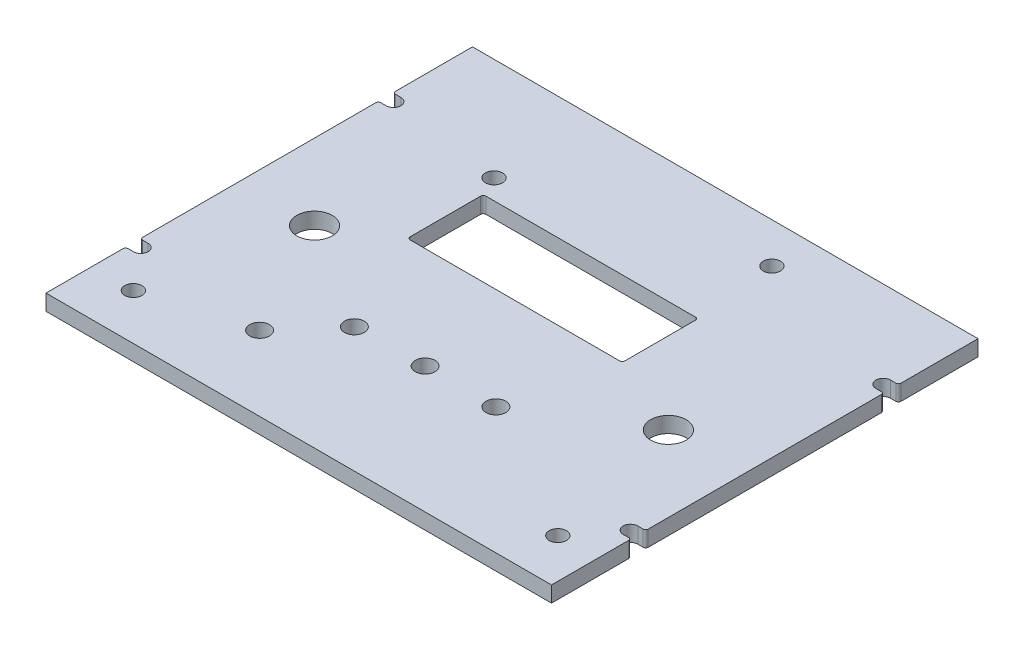
from build123d import *

# Parameters (mm, degrees)
SKETCH1_W                       = 101.6
SKETCH1_H                       = 85.725
BOSS_EXTRUDE1_DEPTH             = 3.175
F_29_0_136_DIAMETER_HOLE1_D     = 3.4544
F_9_32_0_28125_DIAMETER_HOLE1_D = 7.14375
F_5_32_0_15625_DIAMETER_HOLE1_D = 3.96875
SKETCH8_W                       = 43.18
SKETCH8_H                       = 15.24
CUT_EXTRUDE1_DEPTH              = 67.542576831
CUT_EXTRUDE2_DEPTH              = 67.542576831
FILLET1_R                       = 0.508


with BuildPart() as part:
    # Sketch1 → Boss-Extrude1 (new body)
    with BuildSketch(Plane(origin=(0, 0, 0), x_dir=(1, 0, 0), z_dir=(0, 1, 0))):
        Rectangle(SKETCH1_W, SKETCH1_H)
    extrude(amount=BOSS_EXTRUDE1_DEPTH)

    # #29 (0.136) Diameter Hole1 (through all)
    with Locations(Plane(origin=(0, 3.175, 0), x_dir=(1, 0, 0), z_dir=(0, 1, 0))):
        with Locations((-25.8318, 22.2123), (17.4498, 34.7853), (42.8498, -33.6423), (-42.4688, -33.6423)):
            Hole(F_29_0_136_DIAMETER_HOLE1_D / 2)

    # 9/32 (0.28125) Diameter Hole1 (through all)
    with Locations(Plane(origin=(0, 3.175, 0), x_dir=(1, 0, 0), z_dir=(0, 1, 0))):
        with Locations((-35.56, -4.1275), (35.56, -4.1275)):
            Hole(F_9_32_0_28125_DIAMETER_HOLE1_D / 2)

    # 5/32 (0.15625) Diameter Hole1 (through all)
    with Locations(Plane(origin=(0, 3.175, 0), x_dir=(1, 0, 0), z_dir=(0, 1, 0))):
        with Locations((-22.86, -27.8765), (-13.942192497, -17.744307503), (0, -17.4625), (14.224, -17.4625)):
            Hole(F_5_32_0_15625_DIAMETER_HOLE1_D / 2)

    # Sketch8 → Cut-Extrude1 (cut, through all)
    with BuildSketch(Plane(origin=(0, 3.175, 0), x_dir=(1, 0, 0), z_dir=(0, 1, 0))):
        with Locations((-2.413, 10.6045)):
            Rectangle(SKETCH8_W, SKETCH8_H)
    extrude(amount=-CUT_EXTRUDE1_DEPTH, mode=Mode.SUBTRACT)

    # Sketch9 → Cut-Extrude2 (cut, through all)
    with BuildSketch(Plane(origin=(0, 3.175, 0), x_dir=(1, 0, 0), z_dir=(0, 1, 0))):
        with BuildLine():
            Line((-49.2125, 26.8732), (-50.8, 26.8732))
            Line((-50.8, 26.8732), (-50.8, 23.9268))
            Line((-50.8, 23.9268), (-49.2125, 23.9268))
            ThreePointArc((-49.2125, 23.9268), (-47.7393, 25.4), (-49.2125, 26.8732))
        make_face()
        with BuildLine():
            Line((-49.2125, -23.9268), (-50.8, -23.9268))
            Line((-50.8, -23.9268), (-50.8, -26.8732))
            Line((-50.8, -26.8732), (-49.2125, -26.8732))
            ThreePointArc((-49.2125, -26.8732), (-47.7393, -25.4), (-49.2125, -23.9268))
        make_face()
        with BuildLine():
            Line((49.2125, -26.8732), (50.8, -26.8732))
            Line((50.8, -26.8732), (50.8, -23.9268))
            Line((50.8, -23.9268), (49.2125, -23.9268))
            ThreePointArc((49.2125, -23.9268), (47.7393, -25.4), (49.2125, -26.8732))
        make_face()
        with BuildLine():
            Line((50.8, 26.8732), (50.8, 23.9268))
            Line((50.8, 23.9268), (49.2125, 23.9268))
            ThreePointArc((49.2125, 23.9268), (47.7393, 25.4), (49.2125, 26.8732))
            Line((49.2125, 26.8732), (50.8, 26.8732))
        make_face()
    extrude(amount=-CUT_EXTRUDE2_DEPTH, mode=Mode.SUBTRACT)

    # Fillet1
    fillet1_edges = [part.edges().sort_by_distance(p)[0] for p in [
        (50.8, 1.5875, -23.9268),
        (50.8, 1.5875, -26.8732),
        (50.8, 1.5875, 23.9268),
        (50.8, 1.5875, 26.8732),
        (-50.8, 1.5875, 23.9268),
        (-50.8, 1.5875, 26.8732),
        (-50.8, 1.5875, -23.9268),
        (-50.8, 1.5875, -26.8732),
        (-24.003, 1.5875, -2.9845),
        (19.177, 1.5875, -2.9845),
        (19.177, 1.5875, -18.2245),
        (-24.003, 1.5875, -18.2245),
    ]]
    fillet(fillet1_edges, radius=FILLET1_R)


solid = part.part
